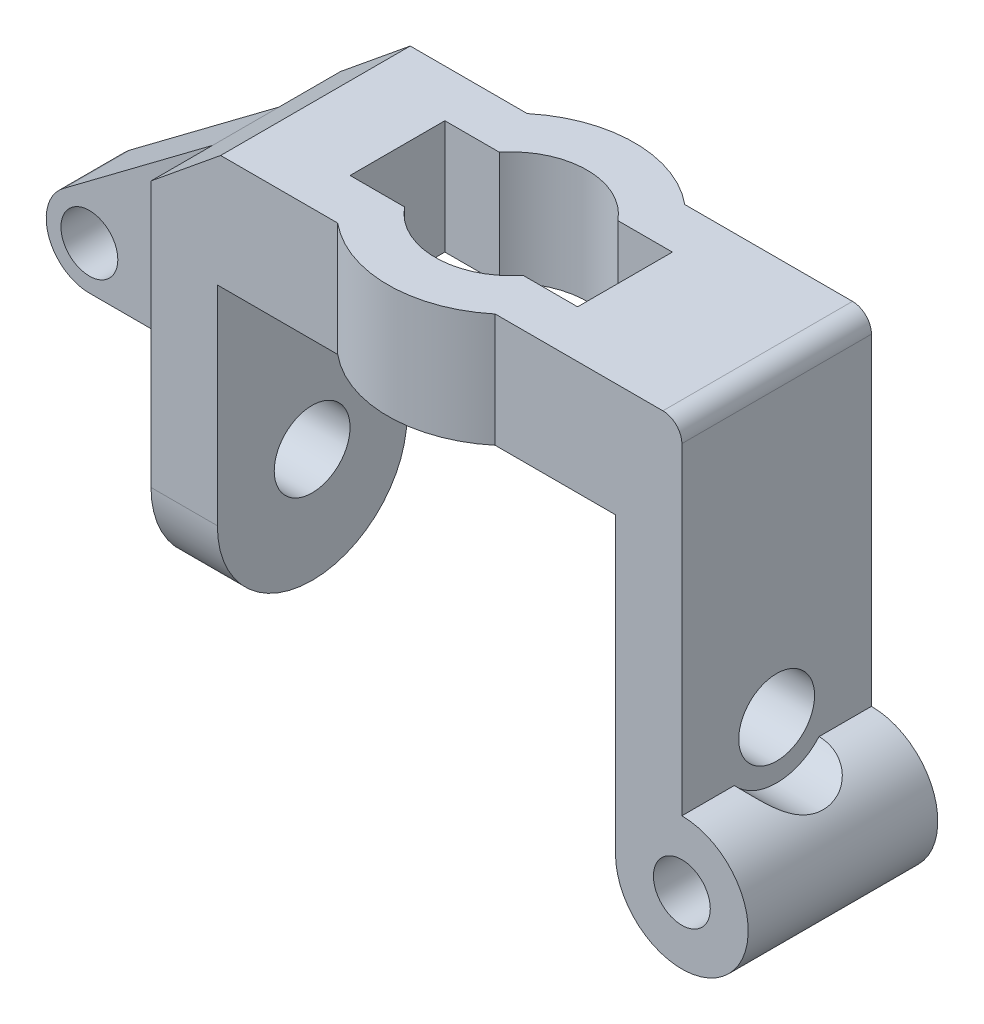
from build123d import *

# Parameters (mm, degrees)
SKETCH1_W                = 3.5
SKETCH1_H                = 16
SKETCH1_W_2              = 21
SKETCH1_H_2              = 6
BOSS_EXTRUDE1_DEPTH      = 10
SKETCH2_R                = 6.5
BOSS_EXTRUDE2_DEPTH      = 6
CUT_EXTRUDE2_DEPTH       = 6
SKETCH5_R                = 1.5
CUT_EXTRUDE3_DEPTH       = 41.10610926
BOSS_EXTRUDE3_DEPTH      = 1.75
BOSS_EXTRUDE3_DEPTH_BACK = 1.75
SKETCH6_R                = 2.277777778
CUT_EXTRUDE6_DEPTH       = 39.967935537
CUT_EXTRUDE6_DEPTH_BACK  = 39.967935537
FILLET1_R                = 1
FILLET2_R                = 5
SKETCH11_R               = 2
CUT_EXTRUDE7_DEPTH       = 41.10610926
SKETCH12_R               = 3
CUT_EXTRUDE8_DEPTH       = 45.371780878
CUT_EXTRUDE9_DEPTH       = 39.967935618
CUT_EXTRUDE9_DEPTH_BACK  = 39.967935618
SKETCH13_R               = 1.5


with BuildPart() as part:
    # Sketch1 → Boss-Extrude1 (new body)
    with BuildSketch(Plane.XY):
        with Locations((1.75, 8)):
            Rectangle(SKETCH1_W, SKETCH1_H)
        with Locations((14, 19)):
            Rectangle(SKETCH1_W_2, SKETCH1_H_2)
        with Locations((1.75, 19)):
            Rectangle(SKETCH1_W, SKETCH1_H_2)
        with Locations((26.25, 19)):
            Rectangle(SKETCH1_W, SKETCH1_H_2)
        with BuildLine():
            Line((28, 16), (24.5, 16))
            Line((24.5, 16), (24.5, 0.5))
            ThreePointArc((24.5, 0.5), (25.525126266, 2.974873734), (28, 4))
            Line((28, 4), (28, 16))
        make_face()
        with BuildLine():
            ThreePointArc((28, 4), (25.525126266, 2.974873734), (24.5, 0.5))
            ThreePointArc((24.5, 0.5), (25.525126266, -1.974873734), (28, -3))
            Line((28, -3), (28, 4))
        make_face()
        with BuildLine():
            ThreePointArc((31.5, 0.5), (30.474873734, 2.974873734), (28, 4))
            Line((28, 4), (28, -3))
            ThreePointArc((28, -3), (30.474873734, -1.974873734), (31.5, 0.5))
        make_face()
        with BuildLine():
            ThreePointArc((28, 4), (25.525126266, 2.974873734), (24.5, 0.5))
            ThreePointArc((24.5, 0.5), (25.525126266, -1.974873734), (28, -3))
            Line((28, -3), (28, 4))
        make_face()
        with BuildLine():
            ThreePointArc((31.5, 0.5), (30.474873734, 2.974873734), (28, 4))
            Line((28, 4), (28, -3))
            ThreePointArc((28, -3), (30.474873734, -1.974873734), (31.5, 0.5))
        make_face()
    extrude(amount=BOSS_EXTRUDE1_DEPTH)

    # Sketch2 → Boss-Extrude2 (add)
    with BuildSketch(Plane(origin=(0, 22, 0), x_dir=(1, 0, 0), z_dir=(0, 1, 0))):
        with Locations((14, -5)):
            Circle(SKETCH2_R)
    extrude(amount=-BOSS_EXTRUDE2_DEPTH)

    # Sketch4 → Cut-Extrude2 (cut)
    with BuildSketch(Plane(origin=(0, 22, 0), x_dir=(1, 0, 0), z_dir=(0, 1, 0))):
        with BuildLine():
            Line((17.122498999, -2.5), (10.877501001, -2.5))
            ThreePointArc((10.877501001, -2.5), (10, -5), (10.877501001, -7.5))
            Line((10.877501001, -7.5), (17.122498999, -7.5))
            ThreePointArc((17.122498999, -7.5), (17.774254628, -6.324764885), (18, -5))
            ThreePointArc((18, -5), (17.774254628, -3.675235115), (17.122498999, -2.5))
        make_face()
        with BuildLine():
            Line((20, -2.5), (17.122498999, -2.5))
            ThreePointArc((17.122498999, -2.5), (17.774254628, -3.675235115), (18, -5))
            ThreePointArc((18, -5), (17.774254628, -6.324764885), (17.122498999, -7.5))
            Line((17.122498999, -7.5), (20, -7.5))
            Line((20, -7.5), (20, -2.5))
        make_face()
        with BuildLine():
            Line((10.877501001, -2.5), (8, -2.5))
            Line((8, -2.5), (8, -7.5))
            Line((8, -7.5), (10.877501001, -7.5))
            ThreePointArc((10.877501001, -7.5), (10, -5), (10.877501001, -2.5))
        make_face()
        with BuildLine():
            ThreePointArc((17.122498999, -2.5), (14, -1), (10.877501001, -2.5))
            Line((10.877501001, -2.5), (17.122498999, -2.5))
        make_face()
        with BuildLine():
            Line((17.122498999, -7.5), (10.877501001, -7.5))
            ThreePointArc((10.877501001, -7.5), (14, -9), (17.122498999, -7.5))
        make_face()
    extrude(amount=-CUT_EXTRUDE2_DEPTH, mode=Mode.SUBTRACT)

    # Sketch5 → Cut-Extrude3 (cut, through all)
    with BuildSketch(Plane.XY.offset(10)):
        with Locations((28, 0.5)):
            Circle(SKETCH5_R)
    extrude(amount=-CUT_EXTRUDE3_DEPTH, mode=Mode.SUBTRACT)

    # Sketch6 → Boss-Extrude3 (add, two sides: drawn at the far end of the back side and taken through both)
    with BuildSketch(Plane.XY.offset(5).offset(-BOSS_EXTRUDE3_DEPTH_BACK)):
        with BuildLine():
            Line((0, 9), (0, 19))
            Line((0, 19), (-7.866666667, 13.1))
            ThreePointArc((-7.866666667, 13.1), (-5.48134681, 13.315084157), (-4.222222222, 11.277777778))
            ThreePointArc((-4.222222222, 11.277777778), (-4.889367887, 9.667145665), (-6.5, 9))
            Line((-6.5, 9), (0, 9))
        make_face()
        with Locations((-6.5, 11.277777778)):
            Circle(SKETCH6_R)
    extrude(amount=BOSS_EXTRUDE3_DEPTH + BOSS_EXTRUDE3_DEPTH_BACK)

    # Sketch10 → Cut-Extrude6 (cut, two sides: drawn at the far end of the back side and taken through both)
    with BuildSketch(Plane.XY.offset(5).offset(-CUT_EXTRUDE6_DEPTH_BACK)):
        Polygon((0, 22), (0, 19), (2.784123139, 21.274018631), (3.672955578, 22), align=None)
    extrude(amount=CUT_EXTRUDE6_DEPTH + CUT_EXTRUDE6_DEPTH_BACK, mode=Mode.SUBTRACT)

    # Fillet1
    fillet1_edges = [part.edges().sort_by_distance(p)[0] for p in [
        (28, 22, 5),
    ]]
    fillet(fillet1_edges, radius=FILLET1_R)

    # Fillet2
    fillet2_edges = [part.edges().sort_by_distance(p)[0] for p in [
        (1.75, 0, 0),
        (1.75, 0, 10),
    ]]
    fillet(fillet2_edges, radius=FILLET2_R - 0.0001)  # a hair under: the kernel refuses the full size

    # Sketch11 → Cut-Extrude7 (cut, through all)
    with BuildSketch(Plane(origin=(0, 0, 0), x_dir=(0, 0, -1), z_dir=(1, 0, 0))):
        with Locations(Location((-5, 6, 0), (0, 0, 270))):
            Circle(SKETCH11_R)
    extrude(amount=CUT_EXTRUDE7_DEPTH, mode=Mode.SUBTRACT)

    # Sketch12 → Cut-Extrude8 (cut, through all)
    with BuildSketch(Plane(origin=(28, 0, 0), x_dir=(0, 0, -1), z_dir=(1, 0, 0))):
        with Locations((-5, 6)):
            Circle(SKETCH12_R)
    extrude(amount=CUT_EXTRUDE8_DEPTH, mode=Mode.SUBTRACT)

    # Sketch13 → Cut-Extrude9 (cut, two sides: drawn at the far end of the back side and taken through both)
    with BuildSketch(Plane.XY.offset(5).offset(-CUT_EXTRUDE9_DEPTH_BACK)):
        with Locations((-6.5, 11.277777778)):
            Circle(SKETCH13_R)
    extrude(amount=CUT_EXTRUDE9_DEPTH + CUT_EXTRUDE9_DEPTH_BACK, mode=Mode.SUBTRACT)


solid = part.part
